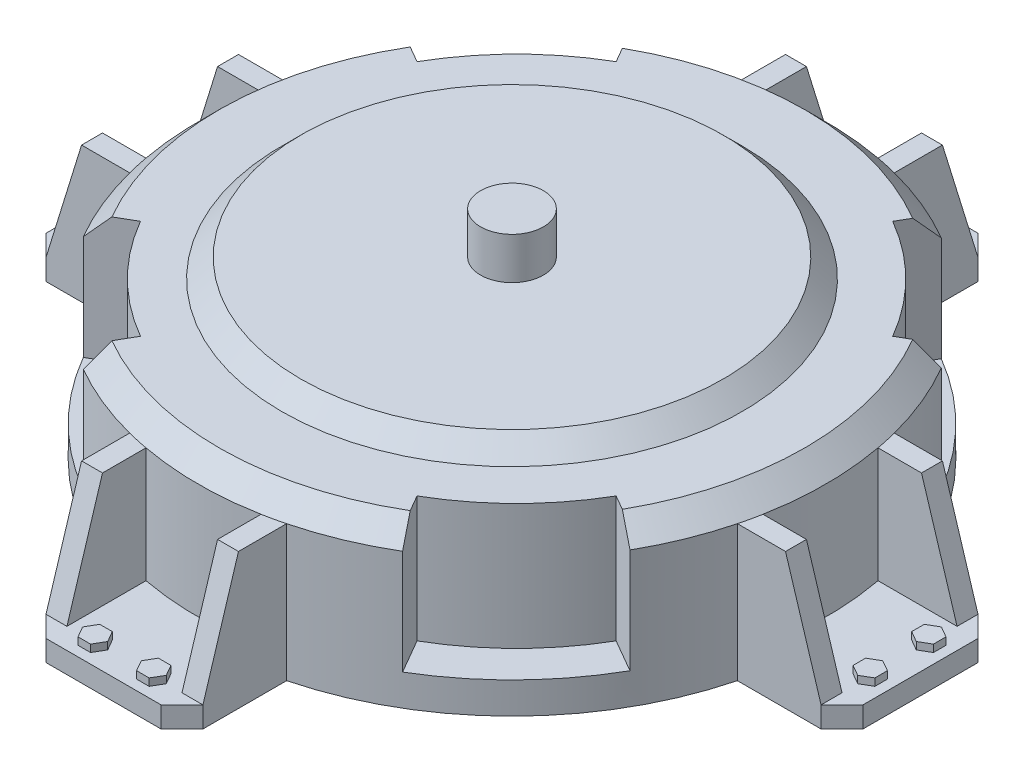
from build123d import *

# Parameters (mm, degrees)
SKETCH1_R                    = 150
BOSS_EXTRUDE1_DEPTH          = 75
CHAMFER1_SIZE                = 10
BOSS_EXTRUDE2_START          = -75
BOSS_EXTRUDE2_DEPTH          = 10
CHAMFER2_SIZE                = 10
BOSS_EXTRUDE3_DEPTH          = 10
BOSS_EXTRUDE4_DEPTH          = 3.5
CIRPATTERN1_COUNT            = 4
CIRPATTERN1_COPY_1_DEPTH     = 10
CIRPATTERN1_COPY_2_DEPTH     = 10
CIRPATTERN1_COPY_3_DEPTH     = 10
CIRPATTERN1_COPY_4_DEPTH     = 3.5
CIRPATTERN1_COPY_5_DEPTH     = 3.5
CIRPATTERN1_COPY_6_DEPTH     = 3.5
CHAMFER2_OF_CIRPATTERN1_SIZE = 10
CUT_EXTRUDE1_START           = -60
CUT_EXTRUDE1_DEPTH           = 60
CIRPATTERN3_COUNT            = 4
SKETCH15_R                   = 110
BOSS_EXTRUDE6_DEPTH          = 9
BOSS_EXTRUDE6_TAPER          = 45
SKETCH16_R                   = 15
BOSS_EXTRUDE7_DEPTH          = 20


# Read off the part's stored shape, not the designer's step: Cut-Extrude1
with BuildPart() as part:
    # Sketch1 → Boss-Extrude1 (new body)
    with BuildSketch(Plane(origin=(0, 0, 0), x_dir=(1, 0, 0), z_dir=(0, 1, 0))):
        with Locations(Location((0, 0, 0), (0, 0, 270))):
            Circle(SKETCH1_R)
    extrude(amount=BOSS_EXTRUDE1_DEPTH)

    # Chamfer1
    chamfer1_edges = [part.edges().sort_by_distance(p)[0] for p in [
        (0, 75, -150),
    ]]
    chamfer(chamfer1_edges, length=CHAMFER1_SIZE)

    # Sketch2 → Boss-Extrude2 (add)
    with BuildSketch(Plane(origin=(0, 75, 0), x_dir=(1, 0, 0), z_dir=(0, 1, 0)).offset(BOSS_EXTRUDE2_START)):
        with BuildLine():
            ThreePointArc((-145.236875483, -37.5), (-148.80445444, -18.900643872), (-150, 0))
            Line((-150, 0), (-195.236875483, 0))
            Line((-195.236875483, 0), (-195.236875483, -37.5))
            Line((-195.236875483, -37.5), (-145.236875483, -37.5))
        make_face()
        with BuildLine():
            Line((-195.236875483, 0), (-150, 0))
            ThreePointArc((-150, 0), (-148.80445444, 18.900643872), (-145.236875483, 37.5))
            Line((-145.236875483, 37.5), (-195.236875483, 37.5))
            Line((-195.236875483, 37.5), (-195.236875483, 0))
        make_face()
    boss_extrude2 = extrude(amount=BOSS_EXTRUDE2_DEPTH)

    # Chamfer2
    chamfer2_edges = [part.edges().sort_by_distance(p)[0] for p in [
        (-195.236875483, 5, -37.5),
        (-195.236875483, 5, 37.5),
    ]]
    chamfer(chamfer2_edges, length=CHAMFER2_SIZE)

    # Sketch5 → Boss-Extrude3 (add)
    with BuildSketch(Plane.XY.offset(37.5)):
        Polygon((-145.236875483, 10), (-145.236875483, 65), (-168.236875483, 65), (-185.236875483, 10), align=None)
    boss_extrude3 = extrude(amount=-BOSS_EXTRUDE3_DEPTH)

    # Sketch7 → Boss-Extrude4 (add)
    with BuildSketch(Plane(origin=(0, 10, 0), x_dir=(1, 0, 0), z_dir=(0, 1, 0))):
        Polygon((-180.034917045, -11.010056312), (-185.225263454, -8), (-190.427221891, -10.989943688), (-190.43883392, -16.989943688), (-185.248487512, -20), (-180.046529075, -17.010056312), align=None)
    boss_extrude4 = extrude(amount=BOSS_EXTRUDE4_DEPTH)

    # Mirror2: Boss-Extrude3, Boss-Extrude4 across plane
    add(boss_extrude3.mirror(Plane.XY))
    add(boss_extrude4.mirror(Plane.XY))

    # CirPattern1: Boss-Extrude2, Boss-Extrude3, Boss-Extrude4 ×4 about axis
    cirpattern1_axis = Axis((0, 0, 0), (0, 1, 0))
    add([boss_extrude2.rotate(cirpattern1_axis, i * 360 / CIRPATTERN1_COUNT) for i in range(1, CIRPATTERN1_COUNT)])
    add([boss_extrude3.rotate(cirpattern1_axis, i * 360 / CIRPATTERN1_COUNT) for i in range(1, CIRPATTERN1_COUNT)])
    add([boss_extrude4.rotate(cirpattern1_axis, i * 360 / CIRPATTERN1_COUNT) for i in range(1, CIRPATTERN1_COUNT)])

    # CirPattern1 copy 1 sketch → CirPattern1 copy 1 (add)
    with BuildSketch(Plane(origin=(-37.5, 0, 0), x_dir=(0, 0, -1), z_dir=(-1, 0, 0))):
        Polygon((-145.236875483, -10), (-145.236875483, -65), (-168.236875483, -65), (-185.236875483, -10), align=None)
    extrude(amount=-CIRPATTERN1_COPY_1_DEPTH)

    # CirPattern1 copy 2 sketch → CirPattern1 copy 2 (add)
    with BuildSketch(Plane(origin=(0, 0, 37.5), x_dir=(-1, 0, 0), z_dir=(0, 0, 1))):
        Polygon((-145.236875483, -10), (-145.236875483, -65), (-168.236875483, -65), (-185.236875483, -10), align=None)
    extrude(amount=-CIRPATTERN1_COPY_2_DEPTH)

    # CirPattern1 copy 3 sketch → CirPattern1 copy 3 (add)
    with BuildSketch(Plane(origin=(37.5, 0, 0), x_dir=(0, 0, 1), z_dir=(1, 0, 0))):
        Polygon((-145.236875483, -10), (-145.236875483, -65), (-168.236875483, -65), (-185.236875483, -10), align=None)
    extrude(amount=-CIRPATTERN1_COPY_3_DEPTH)

    # CirPattern1 copy 4 sketch → CirPattern1 copy 4 (add)
    with BuildSketch(Plane(origin=(0, 10, 0), x_dir=(0, 0, -1), z_dir=(0, 1, 0))):
        Polygon((-180.034917045, 11.010056312), (-185.225263454, 8), (-190.427221891, 10.989943688), (-190.43883392, 16.989943688), (-185.248487512, 20), (-180.046529075, 17.010056312), align=None)
    extrude(amount=CIRPATTERN1_COPY_4_DEPTH)

    # CirPattern1 copy 5 sketch → CirPattern1 copy 5 (add)
    with BuildSketch(Plane(origin=(0, 10, 0), x_dir=(-1, 0, 0), z_dir=(0, 1, 0))):
        Polygon((-180.034917045, 11.010056312), (-185.225263454, 8), (-190.427221891, 10.989943688), (-190.43883392, 16.989943688), (-185.248487512, 20), (-180.046529075, 17.010056312), align=None)
    extrude(amount=CIRPATTERN1_COPY_5_DEPTH)

    # CirPattern1 copy 6 sketch → CirPattern1 copy 6 (add)
    with BuildSketch(Plane.ZX.offset(10)):
        Polygon((-180.034917045, 11.010056312), (-185.225263454, 8), (-190.427221891, 10.989943688), (-190.43883392, 16.989943688), (-185.248487512, 20), (-180.046529075, 17.010056312), align=None)
    extrude(amount=CIRPATTERN1_COPY_6_DEPTH)

    # Chamfer2 of CirPattern1
    chamfer2_of_cirpattern1_edges = [part.edges().sort_by_distance(p)[0] for p in [
        (-37.5, 5, 195.236875483),
        (37.5, 5, 195.236875483),
        (195.236875483, 5, 37.5),
        (195.236875483, 5, -37.5),
        (37.5, 5, -195.236875483),
        (-37.5, 5, -195.236875483),
    ]]
    chamfer(chamfer2_of_cirpattern1_edges, length=CHAMFER2_OF_CIRPATTERN1_SIZE)

    # Cut-Extrude1 outline → Cut-Extrude1 (cut)
    with BuildSketch(Plane(origin=(0, 75, 0), x_dir=(1, 0, 0), z_dir=(0, 1, 0)).offset(CUT_EXTRUDE1_START)):
        with BuildLine():
            ThreePointArc((-65, -112.583302492), (-91.923881554, -91.923881554), (-112.583302492, -65))
            Line((-112.583302492, -65), (-129.903810568, -75))
            ThreePointArc((-129.903810568, -75), (-106.066017178, -106.066017178), (-75, -129.903810568))
            Line((-75, -129.903810568), (-65, -112.583302492))
        make_face()
    cut_extrude1 = extrude(amount=CUT_EXTRUDE1_DEPTH, mode=Mode.SUBTRACT)

    # CirPattern3: Cut-Extrude1 ×4 about axis
    cirpattern3_axis = Axis((1.096442134, 0, -1.096442134), (0, 1, 0))
    for i in range(1, CIRPATTERN3_COUNT):
        add(cut_extrude1.rotate(cirpattern3_axis, i * 360 / CIRPATTERN3_COUNT), mode=Mode.SUBTRACT)

    # Sketch15 → Boss-Extrude6 (add)
    with BuildSketch(Plane(origin=(0, 75, 0), x_dir=(1, 0, 0), z_dir=(0, 1, 0))):
        Circle(SKETCH15_R)
    extrude(amount=BOSS_EXTRUDE6_DEPTH, taper=BOSS_EXTRUDE6_TAPER)

    # Sketch16 → Boss-Extrude7 (add)
    with BuildSketch(Plane(origin=(0, 84, 0), x_dir=(1, 0, 0), z_dir=(0, 1, 0))):
        with Locations(Location((0, 0, 0), (0, 0, 270))):
            Circle(SKETCH16_R)
    extrude(amount=BOSS_EXTRUDE7_DEPTH)


solid = part.part
